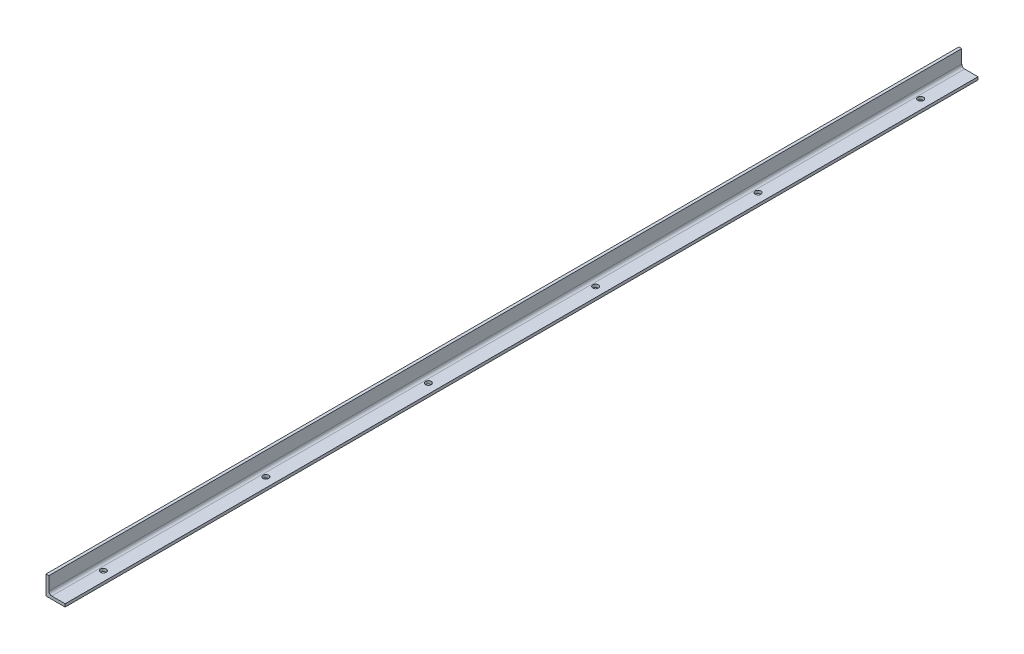
from build123d import *

# Parameters (mm, degrees)
BOSS_EXTRU_1_DEPTH      = 955
ESQUISSE2_R             = 3
ENL_V_MAT_EXTRU_1_DEPTH = 955


with BuildPart() as part:
    # Esquisse1 → Boss.-Extru.1 (new body)
    with BuildSketch(Plane.XY):
        with BuildLine():
            Line((0, 0), (0, 20))
            Line((0, 20), (3, 20))
            Line((3, 20), (3, 6))
            ThreePointArc((3, 6), (3.878679656, 3.878679656), (6, 3))
            Line((6, 3), (20, 3))
            Line((20, 3), (20, 0))
            Line((20, 0), (0, 0))
        make_face()
    extrude(amount=BOSS_EXTRU_1_DEPTH)

    # Esquisse2 → Enlèv. mat.-Extru.1 (cut)
    with BuildSketch(Plane(origin=(0, 0, 0), x_dir=(-1, 0, 0), z_dir=(0, -1, 0))):
        with Locations((-10, -50)):
            Circle(ESQUISSE2_R)
        with Locations((-10, -905)):
            Circle(ESQUISSE2_R)
        with Locations((-10, -220)):
            Circle(ESQUISSE2_R)
        with Locations((-10, -735)):
            Circle(ESQUISSE2_R)
        with Locations((-10, -390)):
            Circle(ESQUISSE2_R)
        with Locations((-10, -565)):
            Circle(ESQUISSE2_R)
    extrude(amount=-ENL_V_MAT_EXTRU_1_DEPTH, mode=Mode.SUBTRACT)


solid = part.part
